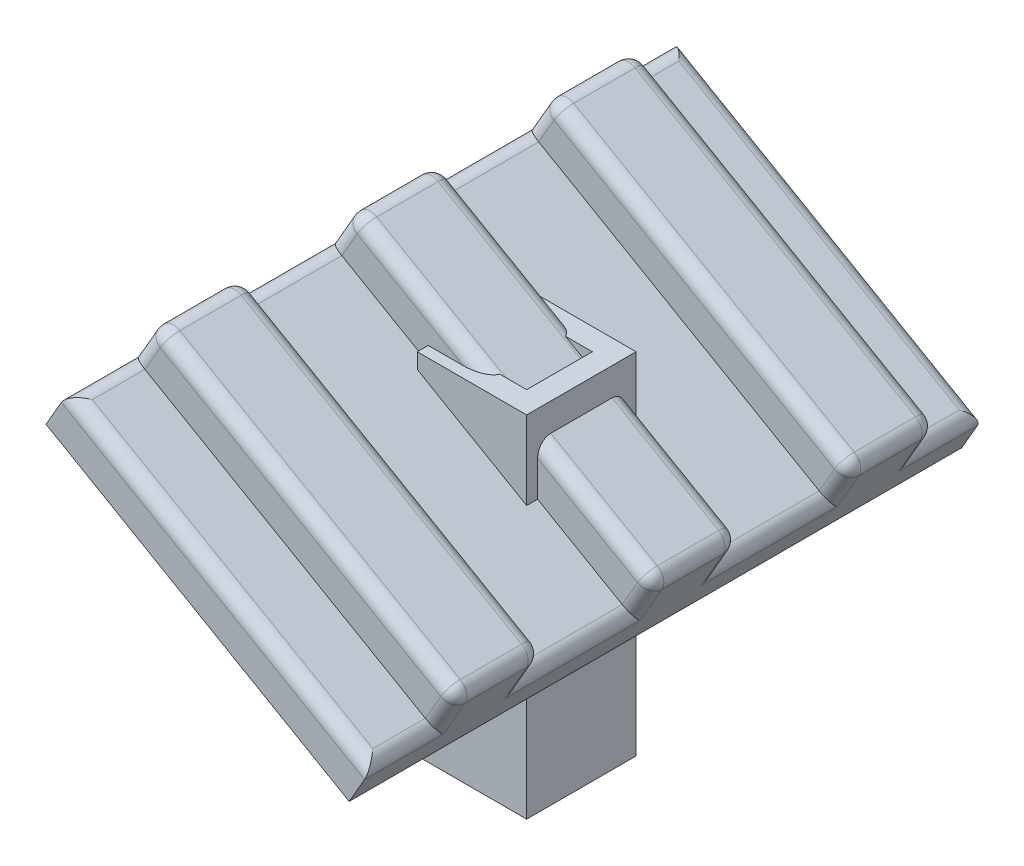
from build123d import *

# Parameters (mm, degrees)
SKETCH1_W           = 2.5
SKETCH1_H           = 2.5
SKETCH1_W_2         = 1.5
SKETCH1_H_2         = 1.5
BOSS_EXTRUDE1_DEPTH = 8
SKETCH3_W           = 14
SKETCH3_H           = 8
BOSS_EXTRUDE2_DEPTH = 1
SKETCH4_W           = 8
SKETCH4_H           = 2
BOSS_EXTRUDE3_DEPTH = 1
FILLET1_R           = 0.3


with BuildPart() as part:
    # Sketch1 → Boss-Extrude1 (new body)
    with BuildSketch(Plane(origin=(0, 0, 0), x_dir=(1, 0, 0), z_dir=(0, 1, 0))):
        Rectangle(SKETCH1_W, SKETCH1_H)
        Rectangle(SKETCH1_W_2, SKETCH1_H_2, mode=Mode.SUBTRACT)
    extrude(amount=BOSS_EXTRUDE1_DEPTH)


with BuildPart() as body_2:
    # Sketch3 → Boss-Extrude2 (new body)
    with BuildSketch(Plane(origin=(2.5, 4.330127019, 0), x_dir=(0, 0, 1), z_dir=(0.500000000000001, 0.866025403784438, 0))):
        with Locations((0, -3.486751346)):
            Rectangle(SKETCH3_W, SKETCH3_H)
    extrude(amount=BOSS_EXTRUDE2_DEPTH)

    # Sketch4 → Boss-Extrude3 (add)
    with BuildSketch(Plane(origin=(3, 5.196152423, 0), x_dir=(0.866025403784438, -0.5000000000000011, 0), z_dir=(0.5000000000000011, 0.8660254037844382, 0))):
        with Locations((-3.486751346, 0)):
            Rectangle(SKETCH4_W, SKETCH4_H)
        with Locations((-3.486751346, 4.5)):
            Rectangle(SKETCH4_W, SKETCH4_H)
        with Locations((-3.486751346, -4.5)):
            Rectangle(SKETCH4_W, SKETCH4_H)
    extrude(amount=BOSS_EXTRUDE3_DEPTH)

    # Fillet1
    fillet1_edges = [body_2.edges().sort_by_distance(p)[0] for p in [
        (-3.233716857, 9.372540798, 3.5),
        (3.694486373, 5.372540798, -5.5),
        (3.694486373, 5.372540798, -1),
        (3.694486373, 5.372540798, -3.5),
        (3.694486373, 5.372540798, 1),
        (3.694486373, 5.372540798, 3.5),
        (3.694486373, 5.372540798, 5.5),
        (-3.233716857, 9.372540798, 5.5),
        (-3.233716857, 9.372540798, 1),
        (-3.233716857, 9.372540798, -1),
        (-3.233716857, 9.372540798, -3.5),
        (-3.233716857, 9.372540798, -5.5),
        (-2.983716857, 9.805553499, 0),
        (3.944486373, 5.805553499, 0),
        (3.444486373, 4.939528096, -6.25),
        (3.944486373, 5.805553499, -4.5),
        (3.444486373, 4.939528096, -2.25),
        (3.444486373, 4.939528096, 2.25),
        (3.444486373, 4.939528096, 6.25),
        (-3.483716857, 8.939528096, 6.25),
        (-2.983716857, 9.805553499, 4.5),
        (-3.483716857, 8.939528096, 2.25),
        (-3.483716857, 8.939528096, -2.25),
        (-3.483716857, 8.939528096, -6.25),
        (-2.983716857, 9.805553499, -4.5),
        (-0.019615242, 6.939528096, 7),
        (0.480384758, 7.805553499, 5.5),
        (0.480384758, 7.805553499, 3.5),
        (0.480384758, 7.805553499, 1),
        (0.480384758, 7.805553499, -1),
        (-0.019615242, 6.939528096, -7),
        (0.480384758, 7.805553499, -5.5),
        (0.480384758, 7.805553499, -3.5),
        (3.944486373, 5.805553499, 4.5),
    ]]
    fillet(fillet1_edges, radius=FILLET1_R)


solid = Compound([part.part, body_2.part])
